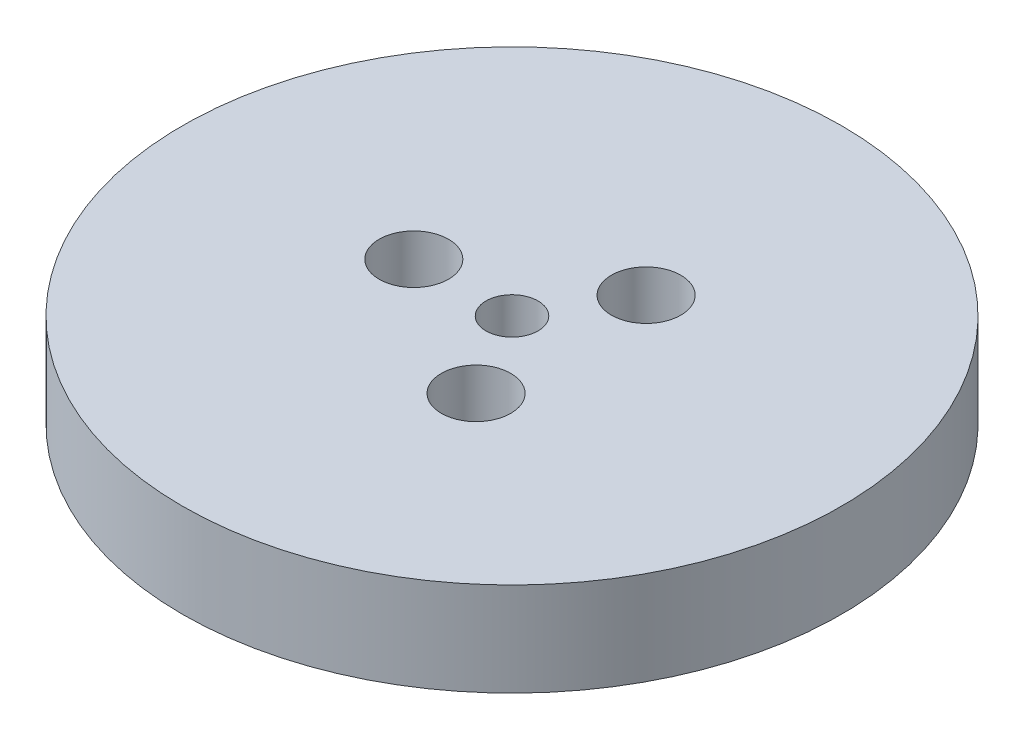
from build123d import *

# Parameters (mm, degrees)
SKETCH1_R           = 95
BOSS_EXTRUDE1_DEPTH = 27
SKETCH2_R           = 7.5
CUT_EXTRUDE1_DEPTH  = 138.03649149
SKETCH3_R           = 10
CUT_EXTRUDE2_DEPTH  = 22.146064054
CIRPATTERN1_COUNT   = 3


with BuildPart() as part:
    # Sketch1 → Boss-Extrude1 (new body)
    with BuildSketch(Plane(origin=(0, 0, 0), x_dir=(1, 0, 0), z_dir=(0, 1, 0))):
        Circle(SKETCH1_R)
    extrude(amount=BOSS_EXTRUDE1_DEPTH)

    # Sketch2 → Cut-Extrude1 (cut, through all)
    with BuildSketch(Plane(origin=(0, 0, 0), x_dir=(1, 0, 0), z_dir=(0, 1, 0))):
        Circle(SKETCH2_R)
    extrude(amount=CUT_EXTRUDE1_DEPTH, mode=Mode.SUBTRACT)

    # Sketch3 → Cut-Extrude2 (cut)
    with BuildSketch(Plane(origin=(0, 27, 0), x_dir=(1, 0, 0), z_dir=(0, 1, 0))):
        with Locations((-28.299847795, 0)):
            Circle(SKETCH3_R)
    cut_extrude2 = extrude(amount=-CUT_EXTRUDE2_DEPTH, mode=Mode.SUBTRACT)

    # CirPattern1: Cut-Extrude2 ×3 about axis
    cirpattern1_axis = Axis((0, 0, 0), (0, 1, 0))
    for i in range(1, CIRPATTERN1_COUNT):
        add(cut_extrude2.rotate(cirpattern1_axis, i * 360 / CIRPATTERN1_COUNT), mode=Mode.SUBTRACT)


solid = part.part
